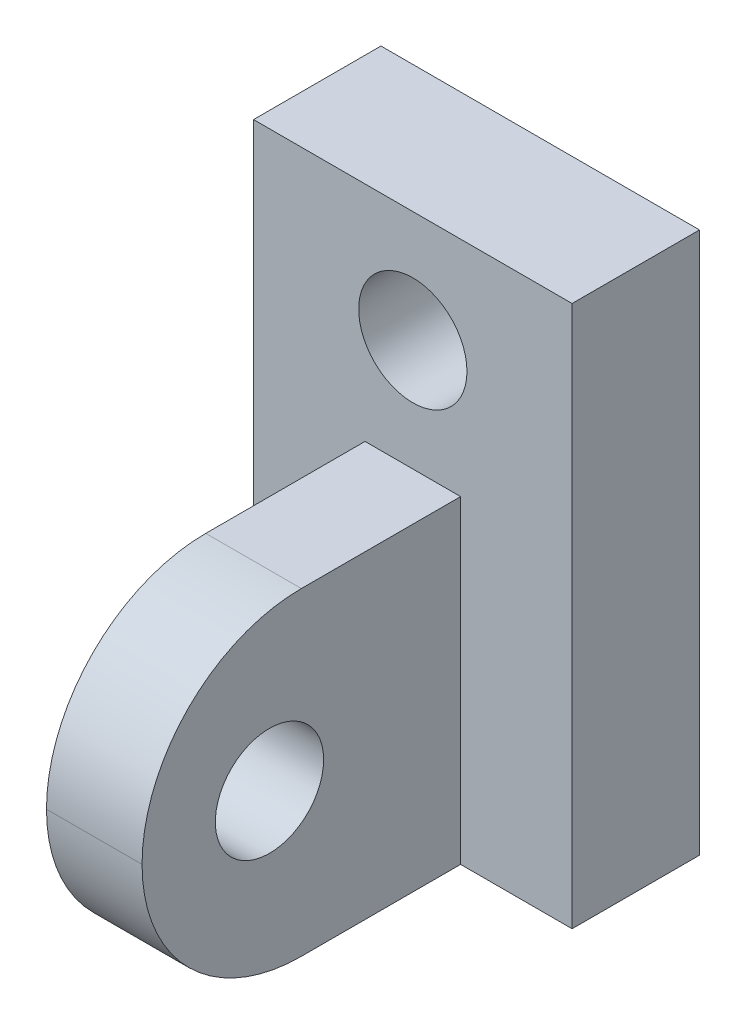
from build123d import *

# Parameters (mm, degrees)
SKETCH1_W                = 3
SKETCH1_H                = 10
BOSS_EXTRUDE1_DEPTH      = 4
SKETCH2_W                = 3
SKETCH2_H                = 10
BOSS_EXTRUDE2_DEPTH      = 10
FILLET1_R                = 5
M3_CLEARANCE_HOLE1_D     = 3.4
M3_CLEARANCE_HOLE1_DEPTH = 70
M3_CLEARANCE_HOLE1_TIP   = 1.021463052
SKETCH6_W                = 10
SKETCH6_H                = 4
BOSS_EXTRUDE3_DEPTH      = 2
M3_CLEARANCE_HOLE2_D     = 3.4
M3_CLEARANCE_HOLE2_DEPTH = 70
M3_CLEARANCE_HOLE2_TIP   = 1.021463052
M3_CLEARANCE_HOLE3_D     = 3.4
M3_CLEARANCE_HOLE3_DEPTH = 70
M3_CLEARANCE_HOLE3_TIP   = 1.021463052


with BuildPart() as part:
    # Sketch1 → Boss-Extrude1 (new body)
    with BuildSketch(Plane.XY):
        Polygon((0, 15), (0, 0), (3.241791175, 0), (3.241791175, 10), (6.241791175, 10), (6.241791175, 0), (10, 0), (10, 15), align=None)
        with Locations((4.741791175, 5)):
            Rectangle(SKETCH1_W, SKETCH1_H)
    extrude(amount=BOSS_EXTRUDE1_DEPTH)

    # Sketch2 → Boss-Extrude2 (add)
    with BuildSketch(Plane.XY.offset(4)):
        with Locations((5, 5)):
            Rectangle(SKETCH2_W, SKETCH2_H)
    extrude(amount=BOSS_EXTRUDE2_DEPTH)

    # Fillet1
    fillet1_edges = [part.edges().sort_by_distance(p)[0] for p in [
        (5, 0, 14),
        (5, 10, 14),
    ]]
    fillet(fillet1_edges, radius=FILLET1_R - 0.0001)  # a hair under: the kernel refuses the full size

    # M3 Clearance Hole1
    with Locations(Plane.XY.offset(4)):
        with Locations((5, 13.5), (12.547675822, 14.055863144)):
            Hole(M3_CLEARANCE_HOLE1_D / 2, depth=M3_CLEARANCE_HOLE1_DEPTH)
            with Locations((0, 0, -(M3_CLEARANCE_HOLE1_DEPTH + M3_CLEARANCE_HOLE1_TIP / 2))):  # 118° drill point
                Cone(0, M3_CLEARANCE_HOLE1_D / 2, M3_CLEARANCE_HOLE1_TIP, mode=Mode.SUBTRACT)

    # Sketch6 → Boss-Extrude3 (add)
    with BuildSketch(Plane(origin=(0, 15, 0), x_dir=(1, 0, 0), z_dir=(0, 1, 0))):
        with Locations((5, -2)):
            Rectangle(SKETCH6_W, SKETCH6_H)
    extrude(amount=BOSS_EXTRUDE3_DEPTH)

    # M3 Clearance Hole2
    with Locations(Plane.XY.offset(4)):
        with Locations((5, 13.5)):
            Hole(M3_CLEARANCE_HOLE2_D / 2, depth=M3_CLEARANCE_HOLE2_DEPTH)
            with Locations((0, 0, -(M3_CLEARANCE_HOLE2_DEPTH + M3_CLEARANCE_HOLE2_TIP / 2))):  # 118° drill point
                Cone(0, M3_CLEARANCE_HOLE2_D / 2, M3_CLEARANCE_HOLE2_TIP, mode=Mode.SUBTRACT)

    # M3 Clearance Hole3
    with Locations(Plane(origin=(6.5, 0, 0), x_dir=(0, 0, -1), z_dir=(1, 0, 0))):
        with Locations((-10, 5)):
            Hole(M3_CLEARANCE_HOLE3_D / 2, depth=M3_CLEARANCE_HOLE3_DEPTH)
            with Locations((0, 0, -(M3_CLEARANCE_HOLE3_DEPTH + M3_CLEARANCE_HOLE3_TIP / 2))):  # 118° drill point
                Cone(0, M3_CLEARANCE_HOLE3_D / 2, M3_CLEARANCE_HOLE3_TIP, mode=Mode.SUBTRACT)


solid = part.part
